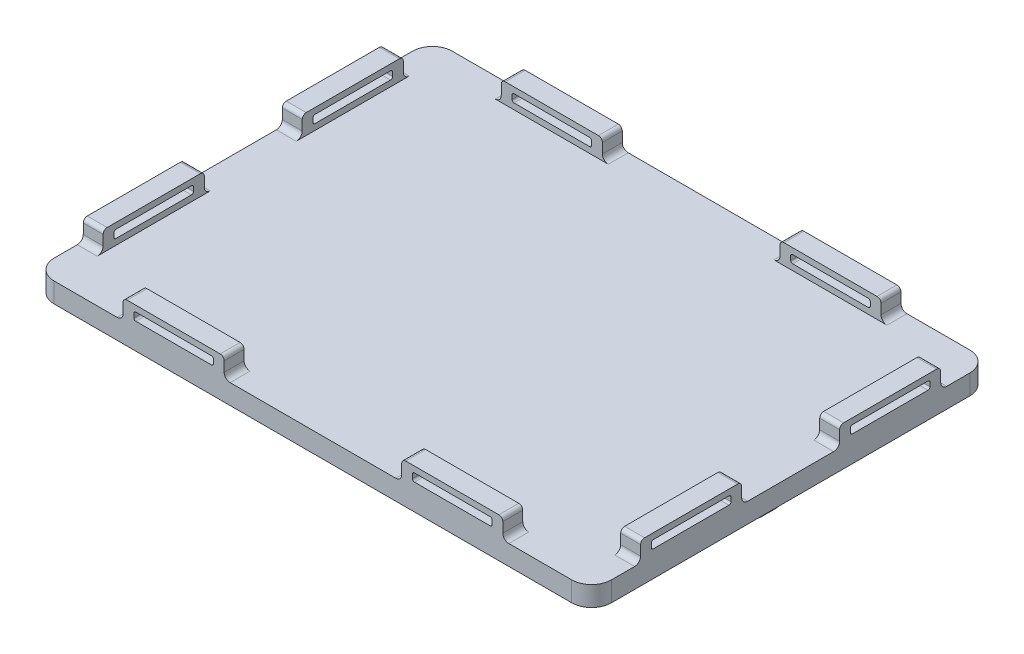
from build123d import *

# Parameters (mm, degrees)
BOSS_EXTRUDE1_DEPTH = 5
SKETCH2_W           = 4
SKETCH2_H           = 9
SKETCH2_W_2         = 9
SKETCH2_H_2         = 4
BOSS_EXTRUDE2_DEPTH = 13
SKETCH3_W           = 5
SKETCH3_H           = 25.4
SKETCH3_W_2         = 25.4
SKETCH3_H_2         = 5
BOSS_EXTRUDE3_DEPTH = 5
CUT_EXTRUDE1_DEPTH  = 173.536952564
CUT_EXTRUDE2_DEPTH  = 173.536952564
FILLET1_R           = 1
FILLET2_R           = 1.5
SKETCH6_R           = 1.55
CUT_EXTRUDE3_DEPTH  = 5
SKETCH7_R           = 1.55
CUT_EXTRUDE4_DEPTH  = 5
FILLET3_R           = 1.5
FILLET4_R           = 1.5


with BuildPart() as part:
    # Sketch1 → Boss-Extrude1 (new body)
    with BuildSketch(Plane(origin=(0, 0, 0), x_dir=(1, 0, 0), z_dir=(0, 1, 0))):
        with BuildLine():
            Line((5, 0), (135, 0))
            ThreePointArc((135, 0), (138.535533906, 1.464466094), (140, 5))
            Line((140, 5), (140, 95))
            ThreePointArc((140, 95), (138.535533906, 98.535533906), (135, 100))
            Line((135, 100), (5, 100))
            ThreePointArc((5, 100), (1.464466094, 98.535533906), (0, 95))
            Line((0, 95), (0, 5))
            ThreePointArc((0, 5), (1.464466094, 1.464466094), (5, 0))
        make_face()
    extrude(amount=BOSS_EXTRUDE1_DEPTH)

    # Sketch2 → Boss-Extrude2 (add)
    with BuildSketch(Plane.XZ):
        with Locations((14, -46.5)):
            Rectangle(SKETCH2_W, SKETCH2_H)
        with Locations((123.5, -57)):
            Rectangle(SKETCH2_W_2, SKETCH2_H_2)
    extrude(amount=BOSS_EXTRUDE2_DEPTH)

    # Sketch3 → Boss-Extrude3 (add)
    with BuildSketch(Plane(origin=(0, 5, 0), x_dir=(1, 0, 0), z_dir=(0, 1, 0))):
        with Locations((2.5, 75)):
            Rectangle(SKETCH3_W, SKETCH3_H)
        with Locations((2.5, 25)):
            Rectangle(SKETCH3_W, SKETCH3_H)
        with Locations((137.5, 75)):
            Rectangle(SKETCH3_W, SKETCH3_H)
        with Locations((137.5, 25)):
            Rectangle(SKETCH3_W, SKETCH3_H)
        with Locations((35, 97.5)):
            Rectangle(SKETCH3_W_2, SKETCH3_H_2)
        with Locations((105, 97.5)):
            Rectangle(SKETCH3_W_2, SKETCH3_H_2)
        with Locations((35, 2.5)):
            Rectangle(SKETCH3_W_2, SKETCH3_H_2)
        with Locations((105, 2.5)):
            Rectangle(SKETCH3_W_2, SKETCH3_H_2)
    extrude(amount=BOSS_EXTRUDE3_DEPTH)

    # Sketch4 → Cut-Extrude1 (cut, through all)
    with BuildSketch(Plane.ZY):
        with BuildLine():
            Line((-84.5, 8.5), (-65.5, 8.5))
            ThreePointArc((-65.5, 8.5), (-65.146446609, 8.353553391), (-65, 8))
            Line((-65, 8), (-65, 7))
            ThreePointArc((-65, 7), (-65.146446609, 6.646446609), (-65.5, 6.5))
            Line((-65.5, 6.5), (-84.5, 6.5))
            ThreePointArc((-84.5, 6.5), (-84.853553391, 6.646446609), (-85, 7))
            Line((-85, 7), (-85, 8))
            ThreePointArc((-85, 8), (-84.853553391, 8.353553391), (-84.5, 8.5))
        make_face()
        with BuildLine():
            Line((-34.5, 8.5), (-15.5, 8.5))
            ThreePointArc((-15.5, 8.5), (-15.146446609, 8.353553391), (-15, 8))
            Line((-15, 8), (-15, 7))
            ThreePointArc((-15, 7), (-15.146446609, 6.646446609), (-15.5, 6.5))
            Line((-15.5, 6.5), (-34.5, 6.5))
            ThreePointArc((-34.5, 6.5), (-34.853553391, 6.646446609), (-35, 7))
            Line((-35, 7), (-35, 8))
            ThreePointArc((-35, 8), (-34.853553391, 8.353553391), (-34.5, 8.5))
        make_face()
    extrude(amount=-CUT_EXTRUDE1_DEPTH, mode=Mode.SUBTRACT)

    # Sketch8 → Cut-Extrude2 (cut, through all)
    with BuildSketch(Plane.XY):
        with BuildLine():
            Line((25.5, 8.5), (44.5, 8.5))
            ThreePointArc((44.5, 8.5), (44.853553391, 8.353553391), (45, 8))
            Line((45, 8), (45, 7))
            ThreePointArc((45, 7), (44.853553391, 6.646446609), (44.5, 6.5))
            Line((44.5, 6.5), (25.5, 6.5))
            ThreePointArc((25.5, 6.5), (25.146446609, 6.646446609), (25, 7))
            Line((25, 7), (25, 8))
            ThreePointArc((25, 8), (25.146446609, 8.353553391), (25.5, 8.5))
        make_face()
        with BuildLine():
            Line((95.5, 8.5), (114.5, 8.5))
            ThreePointArc((114.5, 8.5), (114.853553391, 8.353553391), (115, 8))
            Line((115, 8), (115, 7))
            ThreePointArc((115, 7), (114.853553391, 6.646446609), (114.5, 6.5))
            Line((114.5, 6.5), (95.5, 6.5))
            ThreePointArc((95.5, 6.5), (95.146446609, 6.646446609), (95, 7))
            Line((95, 7), (95, 8))
            ThreePointArc((95, 8), (95.146446609, 8.353553391), (95.5, 8.5))
        make_face()
    extrude(amount=-CUT_EXTRUDE2_DEPTH, mode=Mode.SUBTRACT)

    # Fillet1
    fillet1_edges = [part.edges().sort_by_distance(p)[0] for p in [
        (137.5, 10, -87.7),
        (137.5, 10, -62.3),
        (2.5, 10, -62.3),
        (2.5, 10, -87.7),
        (22.3, 10, -97.5),
        (47.7, 10, -97.5),
        (137.5, 10, -37.7),
        (137.5, 10, -12.3),
        (2.5, 10, -37.7),
        (2.5, 10, -12.3),
        (117.7, 10, -97.5),
        (92.3, 10, -97.5),
        (117.7, 10, -2.5),
        (92.3, 10, -2.5),
        (47.7, 10, -2.5),
        (22.3, 10, -2.5),
    ]]
    fillet(fillet1_edges, radius=FILLET1_R)

    # Fillet2
    fillet2_edges = [part.edges().sort_by_distance(p)[0] for p in [
        (22.3, 5, -97.5),
        (47.7, 5, -97.5),
        (137.5, 5, -62.3),
        (137.5, 5, -87.7),
        (2.5, 5, -87.7),
        (2.5, 5, -62.3),
        (137.5, 5, -37.7),
        (137.5, 5, -12.3),
        (2.5, 5, -37.7),
        (2.5, 5, -12.3),
        (117.7, 5, -97.5),
        (92.3, 5, -97.5),
        (117.7, 5, -2.5),
        (92.3, 5, -2.5),
        (47.7, 5, -2.5),
        (22.3, 5, -2.5),
    ]]
    fillet(fillet2_edges, radius=FILLET2_R)

    # Sketch6 → Cut-Extrude3 (cut)
    with BuildSketch(Plane.ZY.offset(-12)):
        with Locations((-46.5, -9)):
            Circle(SKETCH6_R)
    extrude(amount=-CUT_EXTRUDE3_DEPTH, mode=Mode.SUBTRACT)

    # Sketch7 → Cut-Extrude4 (cut)
    with BuildSketch(Plane.XY.offset(-55)):
        with Locations((123.5, -9)):
            Circle(SKETCH7_R)
    extrude(amount=-CUT_EXTRUDE4_DEPTH, mode=Mode.SUBTRACT)

    # Fillet3
    fillet3_edges = [part.edges().sort_by_distance(p)[0] for p in [
        (128, -13, -57),
        (119, -13, -57),
        (14, -13, -42),
        (14, -13, -51),
    ]]
    fillet(fillet3_edges, radius=FILLET3_R)

    # Fillet4
    fillet4_edges = [part.edges().sort_by_distance(p)[0] for p in [
        (128, 0, -57),
        (119, 0, -57),
        (14, 0, -42),
        (14, 0, -51),
    ]]
    fillet(fillet4_edges, radius=FILLET4_R)


solid = part.part
